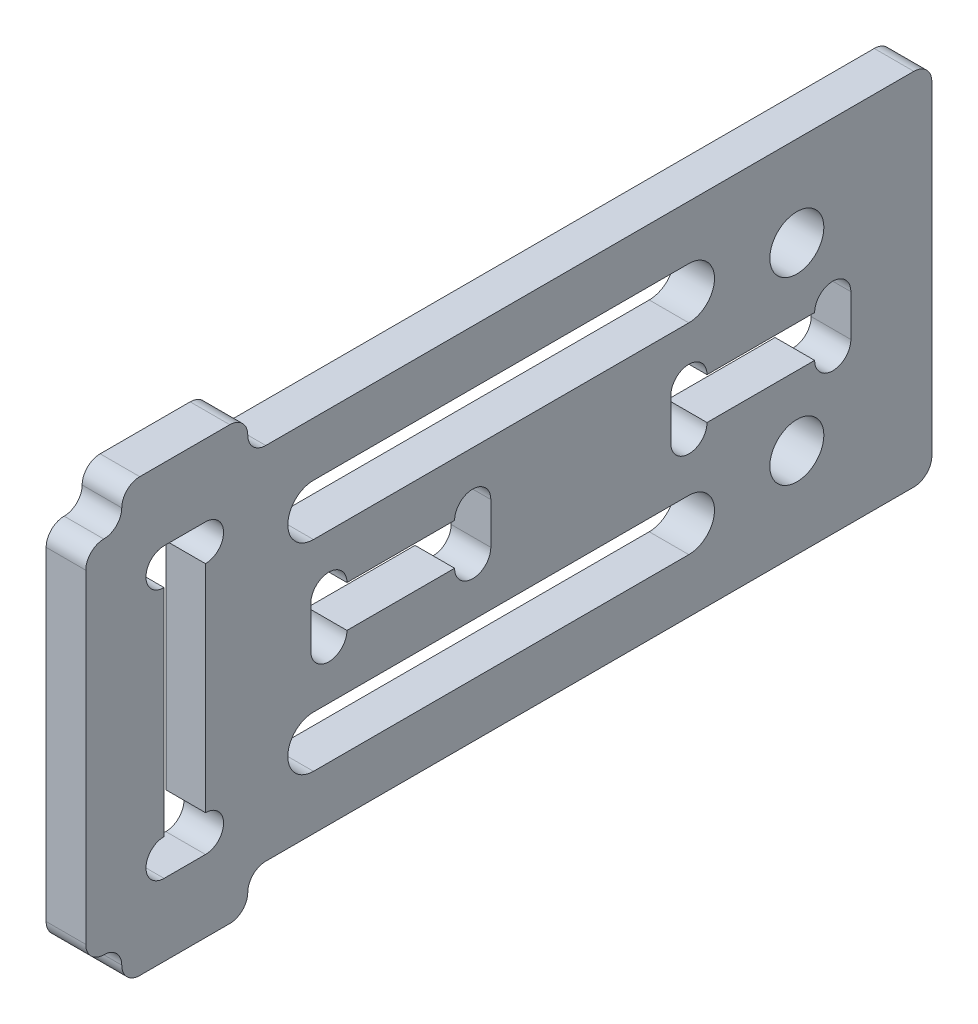
from build123d import *

# Parameters (mm, degrees)
SKETCH_1_R      = 1.5
EXTRUDE_1_DEPTH = 2.2
FILLET_1_R      = 1


with BuildPart() as part:
    # 草图1 → 凸台-拉伸1 (new body)
    with BuildSketch(Plane(origin=(0, 0, 0), x_dir=(0, 0, -1), z_dir=(1, 0, 0))):
        Polygon((-14.5, -10), (23.5, -10), (23.5, 10), (-14.5, 10), (-14.5, 12), (-21.5, 12), (-21.5, 10), (-23.5, 10), (-23.5, -10), (-21.5, -10), (-21.5, -12), (-14.5, -12), align=None)
        with BuildLine():
            ThreePointArc((-15.845, -6.995), (-16.139357685, -7.705642315), (-16.85, -8))
            Line((-16.85, -8), (-19.15, -8))
            ThreePointArc((-19.15, -8), (-20.155, -6.995), (-19.15, -5.99))
            Line((-19.15, -5.99), (-19.15, 5.99))
            ThreePointArc((-19.15, 5.99), (-20.155, 6.995), (-19.15, 8))
            Line((-19.15, 8), (-16.85, 8))
            ThreePointArc((-16.85, 8), (-16.139357685, 7.705642315), (-15.845, 6.995))
            ThreePointArc((-15.845, 6.995), (-16.139357685, 6.284357685), (-16.85, 5.99))
            Line((-16.85, 5.99), (-16.85, -5.99))
            ThreePointArc((-16.85, -5.99), (-16.139357685, -6.284357685), (-15.845, -6.995))
        make_face(mode=Mode.SUBTRACT)
        with BuildLine():
            Line((10, -7), (-10.85, -7))
            ThreePointArc((-10.85, -7), (-12.275, -5.575), (-10.85, -4.15))
            Line((-10.85, -4.15), (10, -4.15))
            ThreePointArc((10, -4.15), (11.425, -5.575), (10, -7))
        make_face(mode=Mode.SUBTRACT)
        with BuildLine():
            Line((-3.01, -1.15), (-8.99, -1.15))
            ThreePointArc((-8.99, -1.15), (-9.995, -2.155), (-11, -1.15))
            Line((-11, -1.15), (-11, 1.15))
            ThreePointArc((-11, 1.15), (-9.995, 2.155), (-8.99, 1.15))
            Line((-8.99, 1.15), (-3.01, 1.15))
            ThreePointArc((-3.01, 1.15), (-2.005, 2.155), (-1, 1.15))
            Line((-1, 1.15), (-1, -1.15))
            ThreePointArc((-1, -1.15), (-2.005, -2.155), (-3.01, -1.15))
        make_face(mode=Mode.SUBTRACT)
        with Locations((16, -5)):
            Circle(SKETCH_1_R, mode=Mode.SUBTRACT)
        with BuildLine():
            ThreePointArc((-10.85, 4.15), (-12.275, 5.575), (-10.85, 7))
            Line((-10.85, 7), (10, 7))
            ThreePointArc((10, 7), (11.425, 5.575), (10, 4.15))
            Line((10, 4.15), (-10.85, 4.15))
        make_face(mode=Mode.SUBTRACT)
        with BuildLine():
            Line((16.99, -1.15), (11.01, -1.15))
            ThreePointArc((11.01, -1.15), (10.005, -2.155), (9, -1.15))
            Line((9, -1.15), (9, 1.15))
            ThreePointArc((9, 1.15), (10.005, 2.155), (11.01, 1.15))
            Line((11.01, 1.15), (16.99, 1.15))
            ThreePointArc((16.99, 1.15), (17.995, 2.155), (19, 1.15))
            Line((19, 1.15), (19, -1.15))
            ThreePointArc((19, -1.15), (17.995, -2.155), (16.99, -1.15))
        make_face(mode=Mode.SUBTRACT)
        with Locations((16, 5)):
            Circle(SKETCH_1_R, mode=Mode.SUBTRACT)
    extrude(amount=EXTRUDE_1_DEPTH)

    # 圆角1
    fillet_1_edges = [part.edges().sort_by_distance(p)[0] for p in [
        (1.1, -10, 23.5),
        (1.1, 10, 23.5),
        (1.1, 12, 14.5),
        (1.1, 10, 14.5),
        (1.1, 10, -23.5),
        (1.1, -10, -23.5),
        (1.1, -10, 14.5),
        (1.1, -12, 14.5),
        (1.1, -12, 21.5),
        (1.1, -10, 21.5),
        (1.1, 12, 21.5),
        (1.1, 10, 21.5),
    ]]
    fillet(fillet_1_edges, radius=FILLET_1_R - 0.0001)  # a hair under: the kernel refuses the full size


solid = part.part
